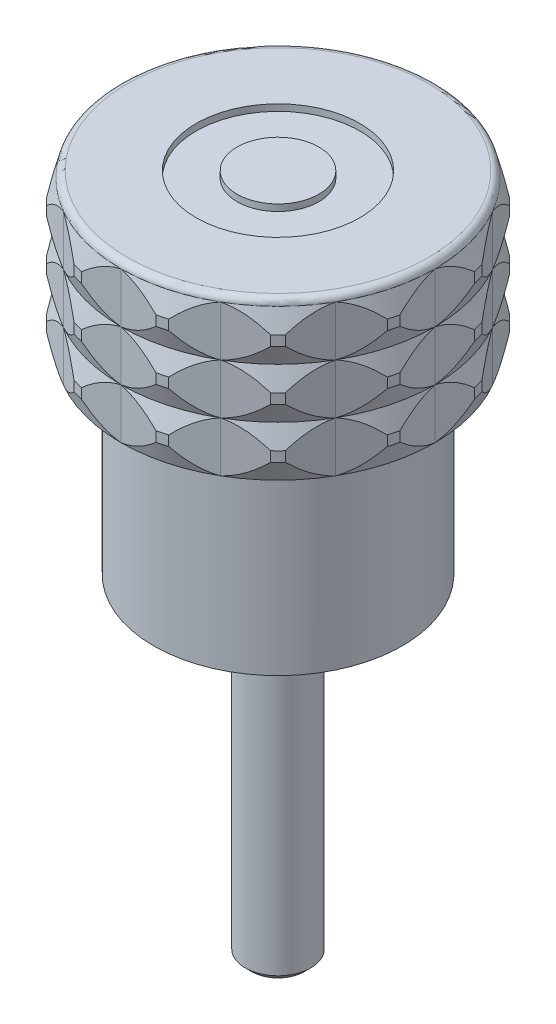
from build123d import *

# Parameters (mm, degrees)
BOSS_EXTRUDE1_OUTLINE_W          = 9.5
BOSS_EXTRUDE1_OUTLINE_H          = 26.7
BOSS_EXTRUDE1_START              = 15
BOSS_EXTRUDE1_2_OUTLINE_R        = 9.5
BOSS_EXTRUDE1_2_DEPTH            = 12
SKETCH2_R                        = 5
BOSS_EXTRUDE2_DEPTH              = 0.3
SKETCH3_R                        = 2.5
BOSS_EXTRUDE3_DEPTH              = 25
F_12_5_12_5_DIAMETER_HOLE1_D     = 12.5
F_12_5_12_5_DIAMETER_HOLE1_DEPTH = 0.5
SKETCH6_W                        = 3.125
SKETCH6_H                        = 0.5
CHAMFER1_SIZE                    = 0.4905


with BuildPart() as part:
    # Boss-Extrude1: read off the stored shape, not the designer's step
    # Boss-Extrude1 outline → Boss-Extrude1 (revolve)
    with BuildSketch(Plane.XY):
        with Locations((4.75, 13.65)):
            Rectangle(BOSS_EXTRUDE1_OUTLINE_W, BOSS_EXTRUDE1_OUTLINE_H)
    revolve(axis=Axis((0, 0, 0), (0, 1, 0)))

    # Boss-Extrude1 2 outline → Boss-Extrude1 2 (add)
    with BuildSketch(Plane(origin=(0, 0, 0), x_dir=(1, 0, 0), z_dir=(0, 1, 0)).offset(BOSS_EXTRUDE1_START)):
        with BuildLine():
            Line((2.85288287, 12.170088715), (0, 12))
            Line((0, 12), (-2.85288287, 12.170088715))
            ThreePointArc((-2.85288287, 12.170088715), (-3.235238064, 12.074072829), (-3.614375318, 11.966047429))
            Line((-3.614375318, 11.966047429), (-6, 10.392304845))
            Line((-6, 10.392304845), (-8.555713397, 9.113164558))
            ThreePointArc((-8.555713397, 9.113164558), (-8.838834765, 8.838834765), (-9.113164558, 8.555713397))
            Line((-9.113164558, 8.555713397), (-10.392304845, 6))
            Line((-10.392304845, 6), (-11.966047429, 3.614375318))
            ThreePointArc((-11.966047429, 3.614375318), (-12.074072829, 3.235238064), (-12.170088715, 2.85288287))
            Line((-12.170088715, 2.85288287), (-12, 0))
            Line((-12, 0), (-12.170088715, -2.85288287))
            ThreePointArc((-12.170088715, -2.85288287), (-12.074072829, -3.235238064), (-11.966047429, -3.614375318))
            Line((-11.966047429, -3.614375318), (-10.392304845, -6))
            Line((-10.392304845, -6), (-9.113164558, -8.555713397))
            ThreePointArc((-9.113164558, -8.555713397), (-8.838834765, -8.838834765), (-8.555713397, -9.113164558))
            Line((-8.555713397, -9.113164558), (-6, -10.392304845))
            Line((-6, -10.392304845), (-3.614375318, -11.966047429))
            ThreePointArc((-3.614375318, -11.966047429), (-3.235238064, -12.074072829), (-2.85288287, -12.170088715))
            Line((-2.85288287, -12.170088715), (0, -12))
            Line((0, -12), (2.85288287, -12.170088715))
            ThreePointArc((2.85288287, -12.170088715), (3.235238064, -12.074072829), (3.614375318, -11.966047429))
            Line((3.614375318, -11.966047429), (6, -10.392304845))
            Line((6, -10.392304845), (8.555713397, -9.113164558))
            ThreePointArc((8.555713397, -9.113164558), (8.838834765, -8.838834765), (9.113164558, -8.555713397))
            Line((9.113164558, -8.555713397), (10.392304845, -6))
            Line((10.392304845, -6), (11.966047429, -3.614375318))
            ThreePointArc((11.966047429, -3.614375318), (12.074072829, -3.235238064), (12.170088715, -2.85288287))
            Line((12.170088715, -2.85288287), (12, 0))
            Line((12, 0), (12.170088715, 2.85288287))
            ThreePointArc((12.170088715, 2.85288287), (12.074072829, 3.235238064), (11.966047429, 3.614375318))
            Line((11.966047429, 3.614375318), (10.392304845, 6))
            Line((10.392304845, 6), (9.113164558, 8.555713397))
            ThreePointArc((9.113164558, 8.555713397), (8.838834765, 8.838834765), (8.555713397, 9.113164558))
            Line((8.555713397, 9.113164558), (6, 10.392304845))
            Line((6, 10.392304845), (3.614375318, 11.966047429))
            ThreePointArc((3.614375318, 11.966047429), (3.235238064, 12.074072829), (2.85288287, 12.170088715))
        make_face()
        Circle(BOSS_EXTRUDE1_2_OUTLINE_R, mode=Mode.SUBTRACT)
    extrude(amount=BOSS_EXTRUDE1_2_DEPTH)

    # Boss-Extrude1 3 outline → Boss-Extrude1 3 (revolve, cut)
    with BuildSketch(Plane.XY):
        with BuildLine():
            ThreePointArc((11.5, 27), (11.853553391, 26.853553391), (12, 26.5))
            Line((12, 26.5), (12.5, 24.966666667))
            Line((12.5, 24.966666667), (12.5, 27))
            Line((12.5, 27), (11.5, 27))
        make_face()
        Polygon((12.5, 21.133333333), (12.5, 24.2), (12, 22.666666667), align=None)
        Polygon((12.5, 16.533333333), (12, 15), (12.5, 15), align=None)
        Polygon((12.5, 17.3), (12.5, 20.366666667), (12, 18.833333333), align=None)
    revolve(axis=Axis((0, 0, 0), (0, 1, 0)), mode=Mode.SUBTRACT)

    # Sketch2 → Boss-Extrude2 (add)
    with BuildSketch(Plane.XZ.offset(-0.3)):
        with Locations(Location((0, 0, 0), (0, 0, 270))):
            Circle(SKETCH2_R)
    extrude(amount=BOSS_EXTRUDE2_DEPTH)

    # Sketch3 → Boss-Extrude3 (add)
    with BuildSketch(Plane.XZ):
        with Locations(Location((0, 0, 0), (0, 0, 270))):
            Circle(SKETCH3_R)
    extrude(amount=BOSS_EXTRUDE3_DEPTH)

    # Ø12.5 (12.5) Diameter Hole1
    with Locations(Plane(origin=(0, 27, 0), x_dir=(1, 0, 0), z_dir=(0, 1, 0))):
        with Locations((0, 0)):
            Hole(F_12_5_12_5_DIAMETER_HOLE1_D / 2, depth=F_12_5_12_5_DIAMETER_HOLE1_DEPTH)

    # Sketch6 → Revolve1 (revolve)
    with BuildSketch(Plane(origin=(0, 0, 0), x_dir=(-1, 0, 0), z_dir=(0, 0, -1)), mode=Mode.PRIVATE) as revolve1_sk:
        with Locations((-1.5625, 26.75)):
            Rectangle(SKETCH6_W, SKETCH6_H)
    revolve(revolve1_sk.sketch.rotate(Axis((0, 26.5, 0), (0, 1, 0)), 270), axis=Axis((0, 26.5, 0), (0, 1, 0)))

    # Chamfer1
    chamfer1_edges = [part.edges().sort_by_distance(p)[0] for p in [
        (0, -25, 2.5),
    ]]
    chamfer(chamfer1_edges, length=CHAMFER1_SIZE)


solid = part.part
